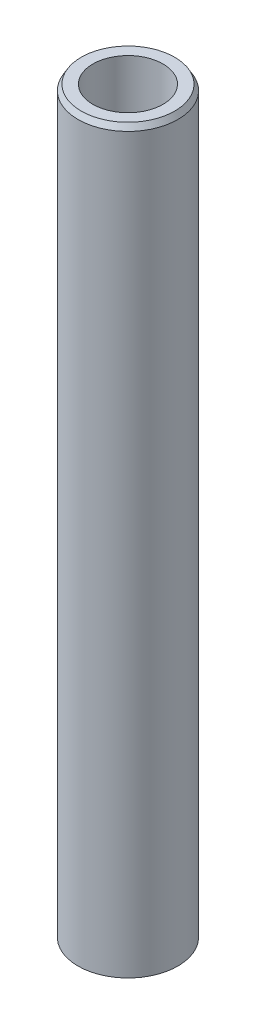
from build123d import *
from OCP.BRepFilletAPI import BRepFilletAPI_MakeChamfer

# Parameters (mm, degrees)
SKETCH1_R           = 15
BOSS_EXTRUDE1_DEPTH = 222.741329279
SKETCH2_R           = 10.519620618
CUT_EXTRUDE1_DEPTH  = 224.749189426
CHAMFER1_SIZE       = 1.689787605
CHAMFER1_SIZE2      = 0.975599329


with BuildPart() as part:
    # Sketch1 → Boss-Extrude1 (new body)
    with BuildSketch(Plane(origin=(0, 0, 0), x_dir=(1, 0, 0), z_dir=(0, 1, 0))):
        Circle(SKETCH1_R)
    extrude(amount=BOSS_EXTRUDE1_DEPTH)

    # Sketch2 → Cut-Extrude1 (cut, through all)
    with BuildSketch(Plane(origin=(0, 0, 0), x_dir=(1, 0, 0), z_dir=(0, 1, 0))):
        Circle(SKETCH2_R)
    extrude(amount=CUT_EXTRUDE1_DEPTH, mode=Mode.SUBTRACT)

    # Chamfer1: one chamfer whose edges measure the first distance from different faces: ONE call of the kernel's chamfer builder (chamfer() names one face for all edges)
    chamfer1_edges_1 = [part.edges().sort_by_distance(p)[0] for p in [
        (-15, 222.741329279, 0),
    ]]
    chamfer1_side_1 = [part.faces().sort_by_distance(p)[0] for p in [
        (-15, 111.370664639, 0),
    ]]
    chamfer1_edges_2 = [part.edges().sort_by_distance(p)[0] for p in [
        (-15, 0, 0),
    ]]
    chamfer1_side_2 = [part.faces().sort_by_distance(p)[0] for p in [
        (-14.575735931, 0, 0),
    ]]
    chamfer1 = BRepFilletAPI_MakeChamfer(part.part.solid().wrapped)
    for e in chamfer1_edges_1:
        chamfer1.Add(CHAMFER1_SIZE, CHAMFER1_SIZE2, e.wrapped, chamfer1_side_1[0].wrapped)  # the first distance lies on this face
    for e in chamfer1_edges_2:
        chamfer1.Add(CHAMFER1_SIZE, CHAMFER1_SIZE2, e.wrapped, chamfer1_side_2[0].wrapped)  # the first distance lies on this face
    add(Compound.cast(chamfer1.Shape()), mode=Mode.REPLACE)


solid = part.part
